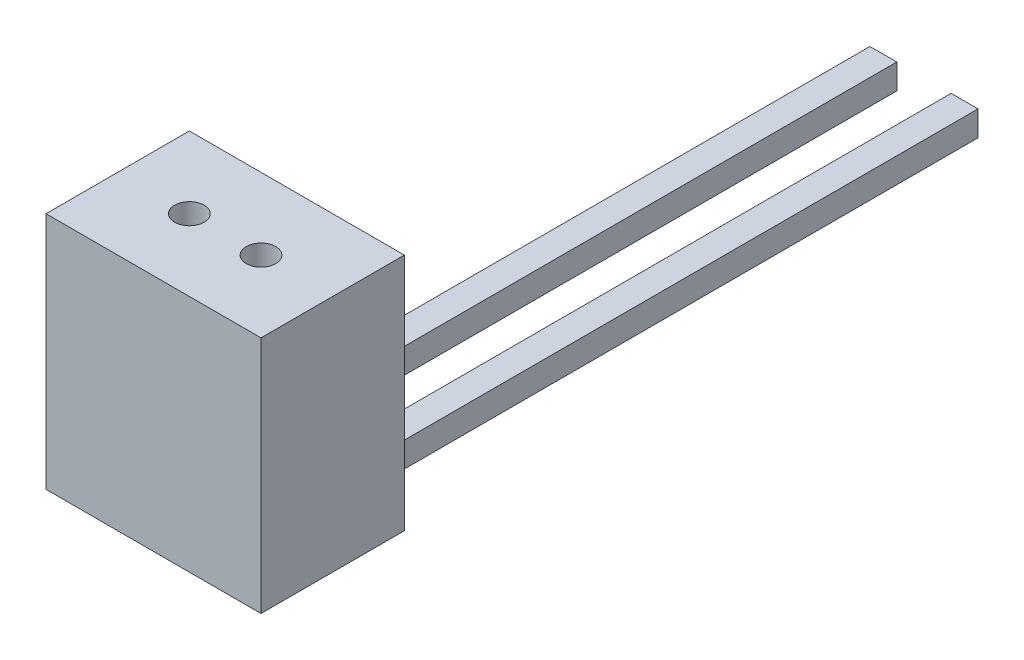
from build123d import *

# Parameters (mm, degrees)
SKETCH2_W             = 3
SKETCH2_H             = 2.8
BOSS_EXTRUDE1_DEPTH   = 70
BOSS_EXTRUDE1_2_DEPTH = 70
SKETCH3_W             = 24
SKETCH3_H             = 26.65
BOSS_EXTRUDE2_DEPTH   = 16
SKETCH4_R             = 1.65
CUT_EXTRUDE1_DEPTH    = 79.652542871
CUT_EXTRUDE2_START    = 3
CUT_EXTRUDE2_DEPTH    = 2.8


with BuildPart() as part:
    # Sketch2 → Boss-Extrude1 (new body)
    with BuildSketch(Plane.XY):
        with Locations((7.466666667, 1.4)):
            Rectangle(SKETCH2_W, SKETCH2_H)
    extrude(amount=-BOSS_EXTRUDE1_DEPTH)



with BuildPart() as body_2:
    # Sketch2 → Boss-Extrude1 2 (new body)
    with BuildSketch(Plane.XY):
        with Locations((16.533333333, 1.4)):
            Rectangle(SKETCH2_W, SKETCH2_H)
    extrude(amount=-BOSS_EXTRUDE1_2_DEPTH)


with BuildPart() as part_1:
    add(part.part)

    add(body_2.part)  # Boss-Extrude2 merges body 2
    # Sketch3 → Boss-Extrude2 (add)
    with BuildSketch(Plane.XY):
        with Locations((12, 13.325)):
            Rectangle(SKETCH3_W, SKETCH3_H)
    extrude(amount=BOSS_EXTRUDE2_DEPTH)

    # Sketch4 → Cut-Extrude1 (cut, through all)
    with BuildSketch(Plane(origin=(0, 0, 0), x_dir=(1, 0, 0), z_dir=(0, 1, 0))):
        with Locations((8, -8)):
            Circle(SKETCH4_R)
        with Locations((16, -8)):
            Circle(SKETCH4_R)
    extrude(amount=CUT_EXTRUDE1_DEPTH, mode=Mode.SUBTRACT)

    # Sketch5 → Cut-Extrude2 (cut)
    with BuildSketch(Plane(origin=(0, 0, 0), x_dir=(1, 0, 0), z_dir=(0, 1, 0)).offset(CUT_EXTRUDE2_START)):
        Polygon((11.290896534, -8), (9.645448267, -5.15), (6.354551733, -5.15), (4.709103466, -8), (6.354551733, -10.85), (9.645448267, -10.85), align=None)
        Polygon((19.290896534, -8), (17.645448267, -5.15), (14.354551733, -5.15), (12.709103466, -8), (14.354551733, -10.85), (17.645448267, -10.85), align=None)
    extrude(amount=CUT_EXTRUDE2_DEPTH, mode=Mode.SUBTRACT)


solid = part_1.part
